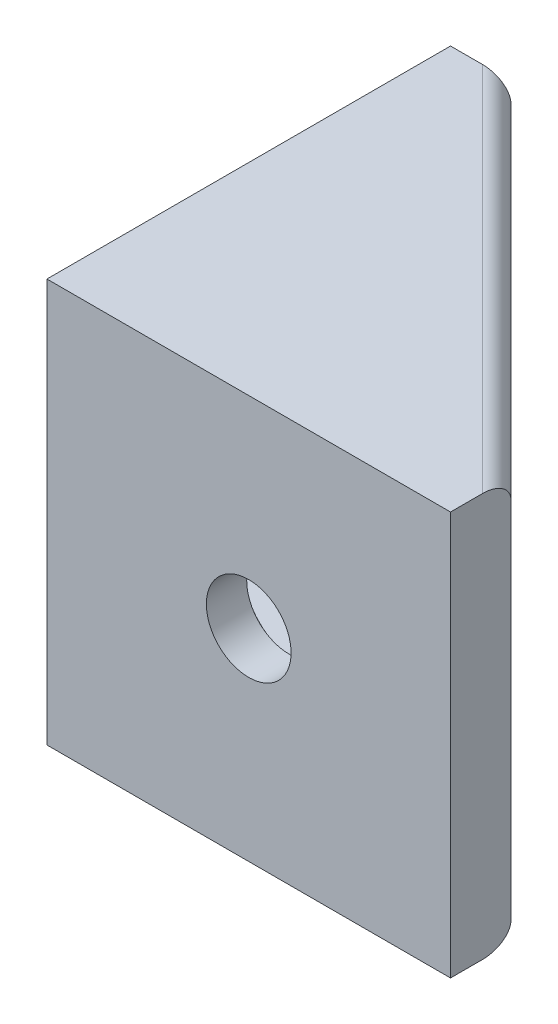
from build123d import *

# Parameters (mm, degrees)
EXTRUDE_1_DEPTH     = 20
EXTRUDE_2_DEPTH     = 3
EXTRUDE_3_DEPTH     = 3
CHAMFER_1_SIZE      = 10
SKETCH_4_R          = 2.1
CUT_EXTRUDE_1_DEPTH = 3
CUT_EXTRUDE_2_DEPTH = 10
FILLET_1_R          = 1
SKETCH_6_R          = 2.1
CUT_EXTRUDE_3_DEPTH = 10
SKETCH_7_R          = 3.5
CUT_EXTRUDE_4_DEPTH = 10
SKETCH_8_W          = 10
SKETCH_8_H          = 10
CUT_EXTRUDE_5_DEPTH = 7
FILLET_2_R          = 1
SKETCH_9_R          = 3.5
CUT_EXTRUDE_6_DEPTH = 1
SKETCH_10_R         = 3.5
CUT_EXTRUDE_7_DEPTH = 1


with BuildPart() as part:
    # 草图1 → 凸台-拉伸1 (new body)
    with BuildSketch(Plane(origin=(0, 0, 0), x_dir=(1, 0, 0), z_dir=(0, 1, 0))):
        Polygon((0, 20), (0, 0), (20, 0), (20, 3), (3, 3), (3, 20), align=None)
    extrude(amount=EXTRUDE_1_DEPTH)

    # 草图2 → 凸台-拉伸2 (add)
    with BuildSketch(Plane(origin=(0, 20, 0), x_dir=(1, 0, 0), z_dir=(0, 1, 0))):
        Polygon((3, 20), (20, 3), (3, 3), align=None)
    extrude(amount=-EXTRUDE_2_DEPTH)

    # 草图3 → 凸台-拉伸3 (add)
    with BuildSketch(Plane.XZ):
        Polygon((20, -3), (3, -20), (3, -3), align=None)
    extrude(amount=-EXTRUDE_3_DEPTH)

    # 倒角1
    chamfer_1_edges = [part.edges().sort_by_distance(p)[0] for p in [
        (3, 10, -3),
    ]]
    chamfer(chamfer_1_edges, length=CHAMFER_1_SIZE)

    # 草图4 → 切除-拉伸1 (cut)
    with BuildSketch(Plane(origin=(0, 0, -3), x_dir=(-1, 0, 0), z_dir=(0, 0, -1))):
        with Locations((-10, 10)):
            Circle(SKETCH_4_R)
    extrude(amount=-CUT_EXTRUDE_1_DEPTH, mode=Mode.SUBTRACT)

    # 草图5 → 切除-拉伸2 (cut)
    with BuildSketch(Plane(origin=(0, 0, -3), x_dir=(-1, 0, 0), z_dir=(0, 0, -1))):
        with BuildLine():
            Line((-10, 13.5), (-13, 13.5))
            Line((-13, 13.5), (-13, 6.5))
            Line((-13, 6.5), (-10, 6.5))
            ThreePointArc((-10, 6.5), (-6.5, 10), (-10, 13.5))
        make_face()
    extrude(amount=CUT_EXTRUDE_2_DEPTH, mode=Mode.SUBTRACT)

    # 圆角1
    fillet_1_edges = [part.edges().sort_by_distance(p)[0] for p in [
        (11.5, 20, -11.5),
        (11.5, 0, -11.5),
    ]]
    fillet(fillet_1_edges, radius=FILLET_1_R)

    # 草图6 → 切除-拉伸3 (cut)
    with BuildSketch(Plane(origin=(3, 0, 0), x_dir=(0, 0, -1), z_dir=(1, 0, 0))):
        with Locations((10, 10)):
            Circle(SKETCH_6_R)
    extrude(amount=-CUT_EXTRUDE_3_DEPTH, mode=Mode.SUBTRACT)

    # 草图7 → 切除-拉伸4 (cut)
    with BuildSketch(Plane.ZY.offset(-3)):
        with Locations((-10, 10)):
            Circle(SKETCH_7_R)
    extrude(amount=-CUT_EXTRUDE_4_DEPTH, mode=Mode.SUBTRACT)

    # 草图8 → 切除-拉伸5 (cut)
    with BuildSketch(Plane.XZ.offset(-13.5)):
        with Locations((8, -8)):
            Rectangle(SKETCH_8_W, SKETCH_8_H)
    extrude(amount=CUT_EXTRUDE_5_DEPTH, mode=Mode.SUBTRACT)

    # 圆角2
    fillet_2_edges = [part.edges().sort_by_distance(p)[0] for p in [
        (8, 17, -8),
        (8, 3, -8),
        (8, 13.5, -8),
        (8, 6.5, -8),
    ]]
    fillet(fillet_2_edges, radius=FILLET_2_R)

    # 草图9 → 切除-拉伸6 (cut)
    with BuildSketch(Plane(origin=(0, 0, -3), x_dir=(-1, 0, 0), z_dir=(0, 0, -1))):
        with Locations((-10, 10)):
            Circle(SKETCH_9_R)
    extrude(amount=-CUT_EXTRUDE_6_DEPTH, mode=Mode.SUBTRACT)

    # 草图10 → 切除-拉伸7 (cut)
    with BuildSketch(Plane(origin=(3, 0, 0), x_dir=(0, 0, -1), z_dir=(1, 0, 0))):
        with Locations((10, 10)):
            Circle(SKETCH_10_R)
    extrude(amount=-CUT_EXTRUDE_7_DEPTH, mode=Mode.SUBTRACT)


solid = part.part
